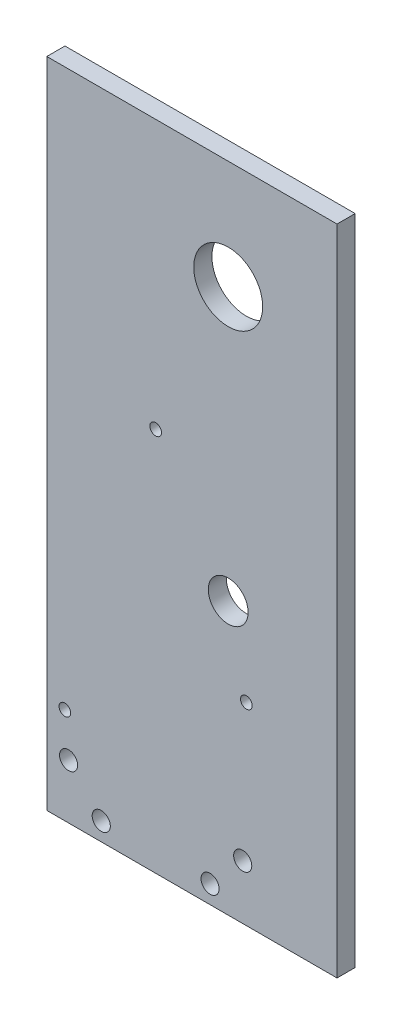
from build123d import *

# Parameters (mm, degrees)
SKETCH1_W           = 80
SKETCH1_H           = 180
SKETCH1_R           = 9.5
BOSS_EXTRUDE1_DEPTH = 5
SKETCH2_R           = 5.5
CUT_EXTRUDE1_DEPTH  = 30
SKETCH3_R           = 1.6
SKETCH3_R_2         = 2.5
CUT_EXTRUDE2_DEPTH  = 5


with BuildPart() as part:
    # Sketch1 → Boss-Extrude1 (new body)
    with BuildSketch(Plane.XY):
        with Locations((10, 166)):
            Rectangle(SKETCH1_W, SKETCH1_H)
        with Locations((20, 226)):
            Circle(SKETCH1_R, mode=Mode.SUBTRACT)
    extrude(amount=BOSS_EXTRUDE1_DEPTH)

    # Sketch2 → Cut-Extrude1 (cut)
    with BuildSketch(Plane.XY.offset(5)):
        with Locations((20, 151)):
            Circle(SKETCH2_R)
    extrude(amount=-CUT_EXTRUDE1_DEPTH, mode=Mode.SUBTRACT)

    # Sketch3 → Cut-Extrude2 (cut)
    with BuildSketch(Plane.XY.offset(5)):
        with Locations((0, 182)):
            Circle(SKETCH3_R)
        with Locations((25, 129.301270189)):
            Circle(SKETCH3_R)
        with Locations((-25.032859693, 102.533479235)):
            Circle(SKETCH3_R)
        with Locations((-15, 81)):
            Circle(SKETCH3_R_2)
        with Locations((15, 81)):
            Circle(SKETCH3_R_2)
        with Locations((24, 91)):
            Circle(SKETCH3_R_2)
        with Locations((-24, 91)):
            Circle(SKETCH3_R_2)
    extrude(amount=-CUT_EXTRUDE2_DEPTH, mode=Mode.SUBTRACT)


solid = part.part
